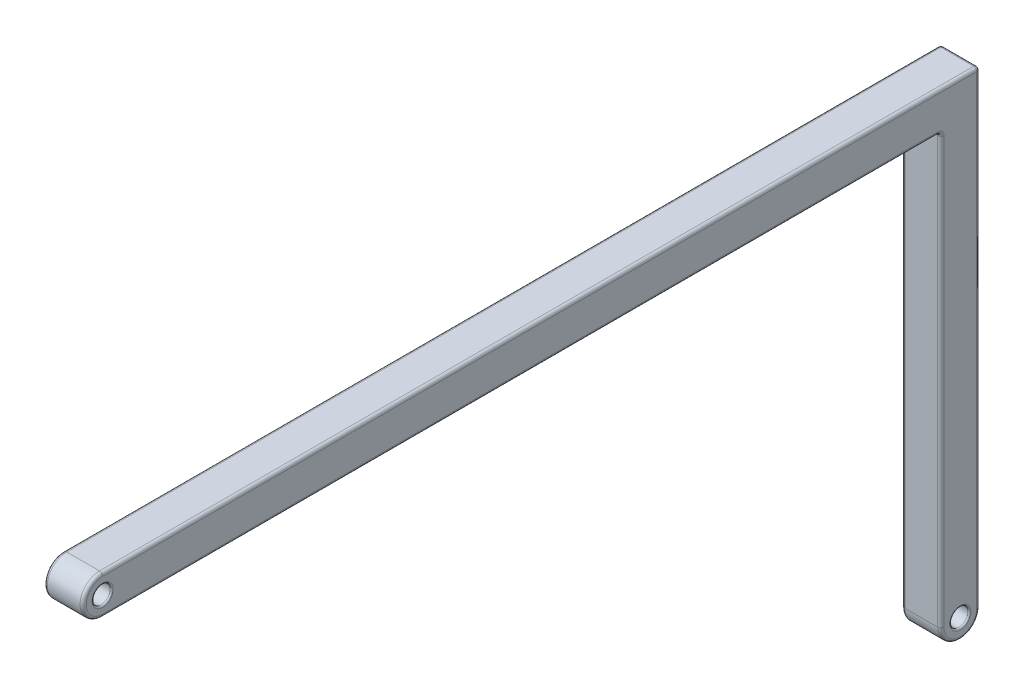
from build123d import *

# Parameters (mm, degrees)
SKETCH1_R           = 0.575
BOSS_EXTRUDE1_DEPTH = 2.5
FILLET2_R           = 0.1
FILLET3_R           = 0.2


with BuildPart() as part:
    # Sketch1 → Boss-Extrude1 (new body)
    with BuildSketch(Plane(origin=(0, 0, 0), x_dir=(0, 0, -1), z_dir=(1, 0, 0))):
        with BuildLine():
            Line((0, 0), (55, 0))
            Line((55, 0), (56.25, 0))
            Line((56.25, 0), (56.25, -30))
            ThreePointArc((56.25, -30), (55, -31.25), (53.75, -30))
            Line((53.75, -30), (53.75, -2.5))
            Line((53.75, -2.5), (0, -2.5))
            ThreePointArc((0, -2.5), (-1.25, -1.25), (0, 0))
        make_face()
        with Locations((0, -1.25)):
            Circle(SKETCH1_R, mode=Mode.SUBTRACT)
        with Locations((55, -30)):
            Circle(SKETCH1_R, mode=Mode.SUBTRACT)
    extrude(amount=BOSS_EXTRUDE1_DEPTH)

    # Fillet2
    fillet2_edges = [part.edges().sort_by_distance(p)[0] for p in [
        (0, -1.25, 0.575),
        (2.5, -1.25, 0.575),
        (0, -30, -54.425),
        (2.5, -30, -54.425),
    ]]
    fillet(fillet2_edges, radius=FILLET2_R)

    # Fillet3
    fillet3_edges = [part.edges().sort_by_distance(p)[0] for p in [
        (2.5, -2.5, -26.875),
        (2.5, -1.25, 1.25),
        (0, -2.5, -26.875),
        (0, -1.25, 1.25),
        (2.5, -15, -56.25),
        (2.5, -31.25, -55),
        (0, -15, -56.25),
        (0, -31.25, -55),
        (1.25, 0, -56.25),
        (2.5, 0, -28.125),
        (0, 0, -28.125),
        (1.25, -2.5, -53.75),
        (2.5, -16.25, -53.75),
        (0, -16.25, -53.75),
    ]]
    fillet(fillet3_edges, radius=FILLET3_R)


solid = part.part
